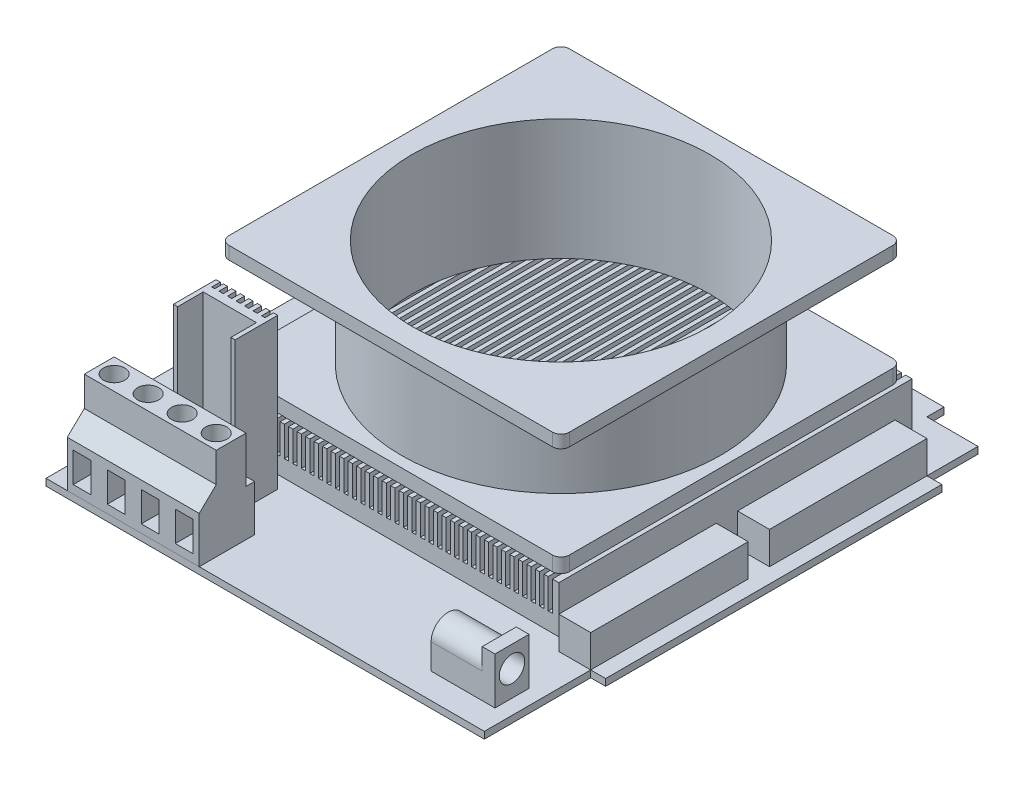
from build123d import *

# Parameters (mm, degrees)
EXTRUDE_1_DEPTH      = 1.6
SKETCH_3_W           = 7.5
SKETCH_3_H           = 79
EXTRUDE_2_DEPTH      = 7.6
EXTRUDE_2_2_DEPTH    = 7.6
SKETCH_4_W           = 82
SKETCH_4_H           = 83
EXTRUDE_3_DEPTH      = 11
EXTRUDE_4_DEPTH      = 28.4
SKETCH_8_W           = 1
SKETCH_8_H           = 8
CUT_EXTRUDE_2_DEPTH  = 115.4
SKETCH_6_W           = 31
SKETCH_6_H           = 13
EXTRUDE_5_DEPTH      = 21.7
EXTRUDE_6_DEPTH      = 35.4
SKETCH_9_W           = 130.811120825
SKETCH_9_H           = 105.268753278
SKETCH_9_R           = 37.5
CUT_EXTRUDE_3_DEPTH  = 22
SKETCH_10_R          = 35
CUT_EXTRUDE_4_DEPTH  = 45
SKETCH_11_W          = 103
SKETCH_11_H          = 5
CUT_EXTRUDE_5_DEPTH  = 25
SKETCH_13_W          = 2
SKETCH_13_H          = 10.85
CUT_EXTRUDE_8_DEPTH  = 45
SKETCH_14_R          = 2.5
CUT_EXTRUDE_9_DEPTH  = 15
SKETCH_15_W          = 4.2
SKETCH_15_H          = 7
CUT_EXTRUDE_10_DEPTH = 12
SKETCH_16_W          = 8
SKETCH_16_H          = 11
EXTRUDE_7_DEPTH      = 15
CUT_EXTRUDE_11_DEPTH = 12
SKETCH_18_R          = 3
CUT_EXTRUDE_12_DEPTH = 12


with BuildPart() as part:
    # 草图2 → 凸台-拉伸1 (new body)
    with BuildSketch(Plane(origin=(0, 0, 0), x_dir=(1, 0, 0), z_dir=(0, 1, 0))):
        Polygon((-51.5, -33), (-51.5, -58), (51.5, -58), (51.5, -33), (55, -33), (55, 46), (51.5, 46), (51.5, 58), (39.5, 58), (39.5, 62), (-39.5, 62), (-39.5, 58), (-51.5, 58), (-51.5, 46), (-55, 46), (-55, -33), align=None)
    extrude(amount=EXTRUDE_1_DEPTH)

    # 草图4 → 凸台-拉伸3 (add)
    with BuildSketch(Plane(origin=(0, 1.6, 0), x_dir=(1, 0, 0), z_dir=(0, 1, 0))):
        with Locations((0, 11.5)):
            Rectangle(SKETCH_4_W, SKETCH_4_H)
    extrude(amount=EXTRUDE_3_DEPTH)

    # 草图8 → 切除-拉伸2 (cut)
    with BuildSketch(Plane.XY.offset(30)):
        with Locations((39, 9.6)):
            Rectangle(SKETCH_8_W, SKETCH_8_H)
        with Locations((37, 9.6)):
            Rectangle(SKETCH_8_W, SKETCH_8_H)
        with Locations((35, 9.6)):
            Rectangle(SKETCH_8_W, SKETCH_8_H)
        with Locations((33, 9.6)):
            Rectangle(SKETCH_8_W, SKETCH_8_H)
        with Locations((31, 9.6)):
            Rectangle(SKETCH_8_W, SKETCH_8_H)
        with Locations((29, 9.6)):
            Rectangle(SKETCH_8_W, SKETCH_8_H)
        with Locations((27, 9.6)):
            Rectangle(SKETCH_8_W, SKETCH_8_H)
        with Locations((25, 9.6)):
            Rectangle(SKETCH_8_W, SKETCH_8_H)
        with Locations((23, 9.6)):
            Rectangle(SKETCH_8_W, SKETCH_8_H)
        with Locations((21, 9.6)):
            Rectangle(SKETCH_8_W, SKETCH_8_H)
        with Locations((19, 9.6)):
            Rectangle(SKETCH_8_W, SKETCH_8_H)
        with Locations((17, 9.6)):
            Rectangle(SKETCH_8_W, SKETCH_8_H)
        with Locations((15, 9.6)):
            Rectangle(SKETCH_8_W, SKETCH_8_H)
        with Locations((13, 9.6)):
            Rectangle(SKETCH_8_W, SKETCH_8_H)
        with Locations((11, 9.6)):
            Rectangle(SKETCH_8_W, SKETCH_8_H)
        with Locations((9, 9.6)):
            Rectangle(SKETCH_8_W, SKETCH_8_H)
        with Locations((7, 9.6)):
            Rectangle(SKETCH_8_W, SKETCH_8_H)
        with Locations((5, 9.6)):
            Rectangle(SKETCH_8_W, SKETCH_8_H)
        with Locations((3, 9.6)):
            Rectangle(SKETCH_8_W, SKETCH_8_H)
        with Locations((1, 9.6)):
            Rectangle(SKETCH_8_W, SKETCH_8_H)
        with Locations((-1, 9.6)):
            Rectangle(SKETCH_8_W, SKETCH_8_H)
        with Locations((-3, 9.6)):
            Rectangle(SKETCH_8_W, SKETCH_8_H)
        with Locations((-5, 9.6)):
            Rectangle(SKETCH_8_W, SKETCH_8_H)
        with Locations((-7, 9.6)):
            Rectangle(SKETCH_8_W, SKETCH_8_H)
        with Locations((-9, 9.6)):
            Rectangle(SKETCH_8_W, SKETCH_8_H)
        with Locations((-11, 9.6)):
            Rectangle(SKETCH_8_W, SKETCH_8_H)
        with Locations((-13, 9.6)):
            Rectangle(SKETCH_8_W, SKETCH_8_H)
        with Locations((-15, 9.6)):
            Rectangle(SKETCH_8_W, SKETCH_8_H)
        with Locations((-17, 9.6)):
            Rectangle(SKETCH_8_W, SKETCH_8_H)
        with Locations((-19, 9.6)):
            Rectangle(SKETCH_8_W, SKETCH_8_H)
        with Locations((-21, 9.6)):
            Rectangle(SKETCH_8_W, SKETCH_8_H)
        with Locations((-23, 9.6)):
            Rectangle(SKETCH_8_W, SKETCH_8_H)
        with Locations((-25, 9.6)):
            Rectangle(SKETCH_8_W, SKETCH_8_H)
        with Locations((-27, 9.6)):
            Rectangle(SKETCH_8_W, SKETCH_8_H)
        with Locations((-29, 9.6)):
            Rectangle(SKETCH_8_W, SKETCH_8_H)
        with Locations((-31, 9.6)):
            Rectangle(SKETCH_8_W, SKETCH_8_H)
        with Locations((-33, 9.6)):
            Rectangle(SKETCH_8_W, SKETCH_8_H)
        with Locations((-35, 9.6)):
            Rectangle(SKETCH_8_W, SKETCH_8_H)
        with Locations((-37, 9.6)):
            Rectangle(SKETCH_8_W, SKETCH_8_H)
        with Locations((-39, 9.6)):
            Rectangle(SKETCH_8_W, SKETCH_8_H)
        with Locations((-41, 9.6)):
            Rectangle(SKETCH_8_W, SKETCH_8_H)
        with Locations((-43, 9.6)):
            Rectangle(SKETCH_8_W, SKETCH_8_H)
        with Locations((-45, 9.6)):
            Rectangle(SKETCH_8_W, SKETCH_8_H)
        with Locations((-47, 9.6)):
            Rectangle(SKETCH_8_W, SKETCH_8_H)
        with Locations((-49, 9.6)):
            Rectangle(SKETCH_8_W, SKETCH_8_H)
        with Locations((-51, 9.6)):
            Rectangle(SKETCH_8_W, SKETCH_8_H)
        with Locations((-53, 9.6)):
            Rectangle(SKETCH_8_W, SKETCH_8_H)
        with Locations((-55, 9.6)):
            Rectangle(SKETCH_8_W, SKETCH_8_H)
        with Locations((-57, 9.6)):
            Rectangle(SKETCH_8_W, SKETCH_8_H)
        with Locations((-59, 9.6)):
            Rectangle(SKETCH_8_W, SKETCH_8_H)
    extrude(amount=-CUT_EXTRUDE_2_DEPTH, mode=Mode.SUBTRACT)


with BuildPart() as body_2:
    # 草图3 → 凸台-拉伸2 (new body)
    with BuildSketch(Plane(origin=(0, 1.6, 0), x_dir=(1, 0, 0), z_dir=(0, 1, 0))):
        with Locations((-47.75, 6.5)):
            Rectangle(SKETCH_3_W, SKETCH_3_H)
    extrude(amount=EXTRUDE_2_DEPTH)


with BuildPart() as body_3:
    # 草图3 → Extrude 2 2 (new body)
    with BuildSketch(Plane(origin=(0, 1.6, 0), x_dir=(1, 0, 0), z_dir=(0, 1, 0))):
        with Locations((47.75, 6.5)):
            Rectangle(SKETCH_3_W, SKETCH_3_H)
    extrude(amount=EXTRUDE_2_2_DEPTH)


with BuildPart() as body_4:
    # 草图5 → 凸台-拉伸4 (new body)
    with BuildSketch(Plane(origin=(0, 12.6, 0), x_dir=(1, 0, 0), z_dir=(0, 1, 0))):
        with BuildLine():
            Line((-38, -28.5), (38, -28.5))
            ThreePointArc((38, -28.5), (39.414213562, -27.914213562), (40, -26.5))
            Line((40, -26.5), (40, 49.5))
            ThreePointArc((40, 49.5), (39.414213562, 50.914213562), (38, 51.5))
            Line((38, 51.5), (-38, 51.5))
            ThreePointArc((-38, 51.5), (-39.414213562, 50.914213562), (-40, 49.5))
            Line((-40, 49.5), (-40, -26.5))
            ThreePointArc((-40, -26.5), (-39.414213562, -27.914213562), (-38, -28.5))
        make_face()
    extrude(amount=EXTRUDE_4_DEPTH)

    # 草图9 → 切除-拉伸3 (cut)
    with BuildSketch(Plane(origin=(0, 38, 0), x_dir=(1, 0, 0), z_dir=(0, 1, 0))):
        with Locations((9.725336597, 10.496310544)):
            Rectangle(SKETCH_9_W, SKETCH_9_H)
        with Locations((0, 11.5)):
            Circle(SKETCH_9_R, mode=Mode.SUBTRACT)
    extrude(amount=-CUT_EXTRUDE_3_DEPTH, mode=Mode.SUBTRACT)

    # 草图10 → 切除-拉伸4 (cut)
    with BuildSketch(Plane(origin=(0, 41, 0), x_dir=(1, 0, 0), z_dir=(0, 1, 0))):
        with Locations((0, 11.5)):
            Circle(SKETCH_10_R)
    extrude(amount=-CUT_EXTRUDE_4_DEPTH, mode=Mode.SUBTRACT)


with BuildPart() as body_5:
    # 草图6 → 凸台-拉伸5 (new body)
    with BuildSketch(Plane(origin=(0, 1.6, 0), x_dir=(1, 0, 0), z_dir=(0, 1, 0))):
        with Locations((-31, -51.5)):
            Rectangle(SKETCH_6_W, SKETCH_6_H)
    extrude(amount=EXTRUDE_5_DEPTH)

    # 草图13 → 切除-拉伸8 (cut)
    with BuildSketch(Plane.ZY.offset(46.5)):
        with Locations((46, 17.875)):
            Rectangle(SKETCH_13_W, SKETCH_13_H)
        Polygon((58, 23.3), (54, 23.3), (54, 16.3), (58, 12.45), align=None)
    extrude(amount=-CUT_EXTRUDE_8_DEPTH, mode=Mode.SUBTRACT)

    # 草图14 → 切除-拉伸9 (cut)
    with BuildSketch(Plane(origin=(0, 23.3, 0), x_dir=(1, 0, 0), z_dir=(0, 1, 0))):
        with Locations((-43, -50.5)):
            Circle(SKETCH_14_R)
        with Locations((-35, -50.5)):
            Circle(SKETCH_14_R)
        with Locations((-27, -50.5)):
            Circle(SKETCH_14_R)
        with Locations((-19, -50.5)):
            Circle(SKETCH_14_R)
    extrude(amount=-CUT_EXTRUDE_9_DEPTH, mode=Mode.SUBTRACT)

    # 草图15 → 切除-拉伸10 (cut)
    with BuildSketch(Plane.XY.offset(58)):
        with Locations((-43, 7.025)):
            Rectangle(SKETCH_15_W, SKETCH_15_H)
        with Locations((-35, 7.025)):
            Rectangle(SKETCH_15_W, SKETCH_15_H)
        with Locations((-27, 7.025)):
            Rectangle(SKETCH_15_W, SKETCH_15_H)
        with Locations((-19, 7.025)):
            Rectangle(SKETCH_15_W, SKETCH_15_H)
    extrude(amount=-CUT_EXTRUDE_10_DEPTH, mode=Mode.SUBTRACT)


with BuildPart() as body_6:
    # 草图7 → 凸台-拉伸6 (new body)
    with BuildSketch(Plane(origin=(0, 1.6, 0), x_dir=(1, 0, 0), z_dir=(0, 1, 0))):
        Polygon((-36.550166113, -33), (-36.550166113, -43), (-35.550166113, -43), (-35.550166113, -37), (-23.050166113, -37), (-23.050166113, -43), (-22.050166113, -43), (-22.050166113, -33), (-23.050166113, -33), (-23.050166113, -35), (-23.850166113, -35), (-23.850166113, -33), (-24.850166113, -33), (-24.850166113, -35), (-25.850166113, -35), (-25.850166113, -33), (-26.850166113, -33), (-26.850166113, -35), (-27.850166113, -35), (-27.850166113, -33), (-28.850166113, -33), (-28.850166113, -35), (-29.850166113, -35), (-29.850166113, -33), (-30.850166113, -33), (-30.850166113, -35), (-31.850166113, -35), (-31.850166113, -33), (-32.850166113, -33), (-32.850166113, -35), (-33.850166113, -35), (-33.850166113, -33), (-34.850166113, -33), (-34.850166113, -35), (-35.550166113, -35), (-35.550166113, -33), align=None)
    extrude(amount=EXTRUDE_6_DEPTH)


with BuildPart() as cut_extrude_5_tool:
    # 草图11 → 切除-拉伸5 (new body)
    with BuildSketch(Plane(origin=(0, 9.2, 0), x_dir=(1, 0, 0), z_dir=(0, 1, 0))):
        with Locations((0, 6.5)):
            Rectangle(SKETCH_11_W, SKETCH_11_H)
    extrude(amount=-CUT_EXTRUDE_5_DEPTH)


with BuildPart() as body_3_1:
    add(body_3.part)

    # 切除-拉伸5: cut by cut_extrude_5_tool
    add(cut_extrude_5_tool.part, mode=Mode.SUBTRACT)


with BuildPart() as body_2_1:
    add(body_2.part)

    # 切除-拉伸5: cut by cut_extrude_5_tool
    add(cut_extrude_5_tool.part, mode=Mode.SUBTRACT)


with BuildPart() as cut_extrude_5_piece_1:
    # of the separate pieces the step leaves, piece 1, a body of its own (cut_extrude_5_pieces)
    add(body_2_1.part.solids().sort_by_distance((-51.5, 1.6, -46))[0])


with BuildPart() as cut_extrude_5_piece_2:
    # of the separate pieces the step leaves, piece 2, a body of its own (cut_extrude_5_pieces)
    add(body_2_1.part.solids().sort_by_distance((-51.5, 1.6, 33))[0])


with BuildPart() as cut_extrude_5_piece_1_of_body_3:
    # of the separate pieces the step leaves, piece 1, a body of its own (cut_extrude_5_pieces_of_body_3)
    add(body_3_1.part.solids().sort_by_distance((51.5, 1.6, -46))[0])


with BuildPart() as cut_extrude_5_piece_2_of_body_3:
    # of the separate pieces the step leaves, piece 2, a body of its own (cut_extrude_5_pieces_of_body_3)
    add(body_3_1.part.solids().sort_by_distance((51.5, 1.6, 33))[0])


with BuildPart() as body_9:
    # 草图16 → 凸台-拉伸7 (new body)
    with BuildSketch(Plane(origin=(48, 0, 0), x_dir=(0, 0, -1), z_dir=(1, 0, 0))):
        with Locations((-48, 7.1)):
            Rectangle(SKETCH_16_W, SKETCH_16_H)
    extrude(amount=-EXTRUDE_7_DEPTH)

    # 草图17 → 切除-拉伸11 (cut)
    with BuildSketch(Plane.ZY.offset(-33)):
        with BuildLine():
            Line((52, 12.6), (44, 12.6))
            Line((44, 12.6), (44, 7.6))
            ThreePointArc((44, 7.6), (48, 11.6), (52, 7.6))
            Line((52, 7.6), (52, 12.6))
        make_face()
    extrude(amount=-CUT_EXTRUDE_11_DEPTH, mode=Mode.SUBTRACT)

    # 草图18 → 切除-拉伸12 (cut)
    with BuildSketch(Plane(origin=(48, 0, 0), x_dir=(0, 0, -1), z_dir=(1, 0, 0))):
        with Locations((-48, 7.6)):
            Circle(SKETCH_18_R)
    extrude(amount=-CUT_EXTRUDE_12_DEPTH, mode=Mode.SUBTRACT)


solid = Compound([part.part, body_4.part, body_5.part, body_6.part, cut_extrude_5_piece_1.part, cut_extrude_5_piece_2.part, cut_extrude_5_piece_1_of_body_3.part, cut_extrude_5_piece_2_of_body_3.part, body_9.part])
